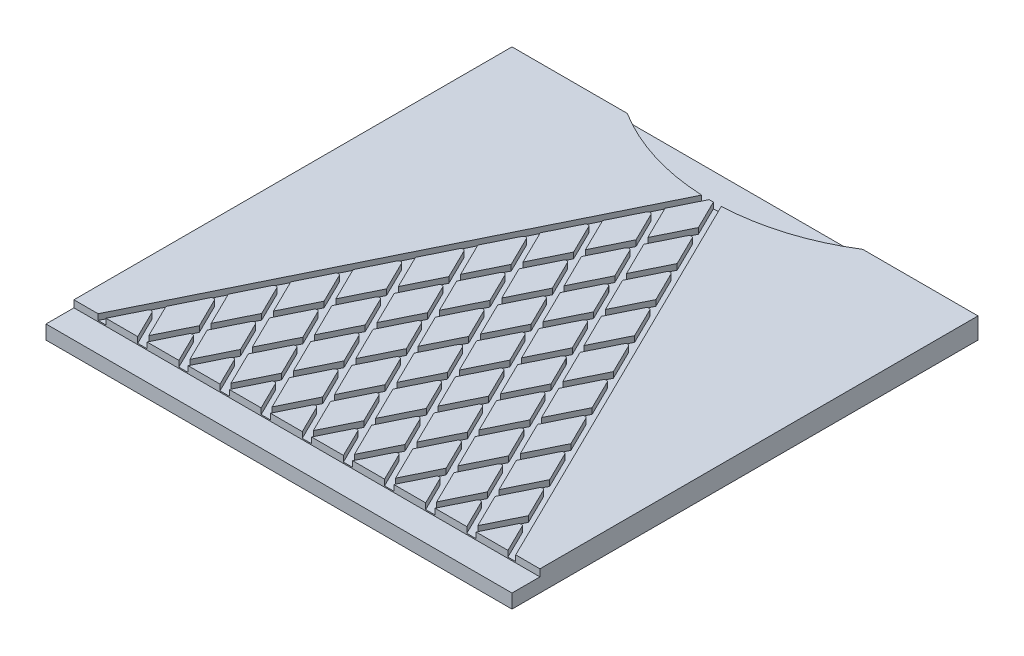
from build123d import *

# Parameters (mm, degrees)
ESQUISSE1_W                     = 400
ESQUISSE1_H                     = 400
BOSS_EXTRU_1_DEPTH              = 18
ENL_V_START                     = -5
ENL_V_DE_MAT_EXTRU_MINCE2_DEPTH = 5
CONG_1_R                        = 2
BACHAUT_DEPTH                   = 6
ESQUISSE5_W                     = 400
ESQUISSE5_H                     = 23.968928741
BACBAS_DEPTH                    = 6


# Read off the part's stored shape, not the designer's step: Enlèv. de mat.-Extru.-Mince2
with BuildPart() as part:
    # Esquisse1 → Boss.-Extru.1 (new body)
    with BuildSketch(Plane(origin=(0, 0, 0), x_dir=(1, 0, 0), z_dir=(0, 1, 0))):
        Rectangle(ESQUISSE1_W, ESQUISSE1_H)
    extrude(amount=BOSS_EXTRU_1_DEPTH)

    # Enlèv. de mat.-Extru.-Mince2 outline → Enlèv. de mat.-Extru.-Mince2 (cut)
    with BuildSketch(Plane(origin=(0, 18, 0), x_dir=(1, 0, 0), z_dir=(0, 1, 0)).offset(ENL_V_START)):
        Polygon((-173.855135903, -178.67927798), (-158.892403305, -148.259175343), (-141.237691827, -184.152227075), (-123.582980348, -148.259175343), (-105.92826887, -184.152227075), (-88.273557392, -148.259175343), (-70.618845913, -184.152227075), (-52.964134435, -148.259175343), (-35.309422957, -184.152227075), (-17.654711478, -148.259175343), (0, -184.152227075), (17.654711478, -148.259175343), (35.309422957, -184.152227075), (52.964134435, -148.259175343), (70.618845913, -184.152227075), (88.273557392, -148.259175343), (105.92826887, -184.152227075), (123.582980348, -148.259175343), (141.237691827, -184.152227075), (158.892403305, -148.259175343), (173.855135903, -178.67927798), (179.239093663, -176.031071259), (0, 188.372395153), (-179.239093663, -176.031071259), align=None)
        Polygon((-155.549137848, -141.462122888), (-141.237691827, -112.366123611), (-126.926245805, -141.462122888), (-141.237691827, -170.558122164), align=None, mode=Mode.SUBTRACT)
        Polygon((-105.92826887, -112.366123611), (-91.616822849, -141.462122888), (-105.92826887, -170.558122164), (-120.239714891, -141.462122888), align=None, mode=Mode.SUBTRACT)
        Polygon((-137.89442637, -105.569071156), (-123.582980348, -76.47307188), (-109.271534327, -105.569071156), (-123.582980348, -134.665070433), align=None, mode=Mode.SUBTRACT)
        Polygon((-56.307399892, -141.462122888), (-70.618845913, -170.558122164), (-84.930291935, -141.462122888), (-70.618845913, -112.366123611), align=None, mode=Mode.SUBTRACT)
        Polygon((-20.997976935, -141.462122888), (-35.309422957, -170.558122164), (-49.620868978, -141.462122888), (-35.309422957, -112.366123611), align=None, mode=Mode.SUBTRACT)
        Polygon((-88.273557392, -76.47307188), (-73.96211137, -105.569071156), (-88.273557392, -134.665070433), (-102.585003413, -105.569071156), align=None, mode=Mode.SUBTRACT)
        Polygon((-38.652688414, -105.569071156), (-52.964134435, -134.665070433), (-67.275580456, -105.569071156), (-52.964134435, -76.47307188), align=None, mode=Mode.SUBTRACT)
        Polygon((-17.654711478, -76.47307188), (-3.343265457, -105.569071156), (-17.654711478, -134.665070433), (-31.9661575, -105.569071156), align=None, mode=Mode.SUBTRACT)
        Polygon((-120.239714891, -69.676019424), (-105.92826887, -40.580020148), (-91.616822849, -69.676019424), (-105.92826887, -98.772018701), align=None, mode=Mode.SUBTRACT)
        Polygon((-70.618845913, -40.580020148), (-56.307399892, -69.676019424), (-70.618845913, -98.772018701), (-84.930291935, -69.676019424), align=None, mode=Mode.SUBTRACT)
        Polygon((-20.997976935, -69.676019424), (-35.309422957, -98.772018701), (-49.620868978, -69.676019424), (-35.309422957, -40.580020148), align=None, mode=Mode.SUBTRACT)
        Polygon((-102.585003413, -33.782967693), (-88.273557392, -4.686968416), (-73.96211137, -33.782967693), (-88.273557392, -62.878966969), align=None, mode=Mode.SUBTRACT)
        Polygon((-52.964134435, -4.686968416), (-38.652688414, -33.782967693), (-52.964134435, -62.878966969), (-67.275580456, -33.782967693), align=None, mode=Mode.SUBTRACT)
        Polygon((-17.654711478, -4.686968416), (-3.343265457, -33.782967693), (-17.654711478, -62.878966969), (-31.9661575, -33.782967693), align=None, mode=Mode.SUBTRACT)
        Polygon((0, -112.366123611), (14.311446021, -141.462122888), (0, -170.558122164), (-14.311446021, -141.462122888), align=None, mode=Mode.SUBTRACT)
        Polygon((20.997976935, -141.462122888), (35.309422957, -112.366123611), (49.620868978, -141.462122888), (35.309422957, -170.558122164), align=None, mode=Mode.SUBTRACT)
        Polygon((56.307399892, -141.462122888), (70.618845913, -112.366123611), (84.930291935, -141.462122888), (70.618845913, -170.558122164), align=None, mode=Mode.SUBTRACT)
        Polygon((17.654711478, -76.47307188), (31.9661575, -105.569071156), (17.654711478, -134.665070433), (3.343265457, -105.569071156), align=None, mode=Mode.SUBTRACT)
        Polygon((38.652688414, -105.569071156), (52.964134435, -76.47307188), (67.275580456, -105.569071156), (52.964134435, -134.665070433), align=None, mode=Mode.SUBTRACT)
        Polygon((88.273557392, -76.47307188), (102.585003413, -105.569071156), (88.273557392, -134.665070433), (73.96211137, -105.569071156), align=None, mode=Mode.SUBTRACT)
        Polygon((120.239714891, -141.462122888), (105.92826887, -170.558122164), (91.616822849, -141.462122888), (105.92826887, -112.366123611), align=None, mode=Mode.SUBTRACT)
        Polygon((126.926245805, -141.462122888), (141.237691827, -112.366123611), (155.549137848, -141.462122888), (141.237691827, -170.558122164), align=None, mode=Mode.SUBTRACT)
        Polygon((109.271534327, -105.569071156), (123.582980348, -76.47307188), (137.89442637, -105.569071156), (123.582980348, -134.665070433), align=None, mode=Mode.SUBTRACT)
        Polygon((0, -40.580020148), (14.311446021, -69.676019424), (0, -98.772018701), (-14.311446021, -69.676019424), align=None, mode=Mode.SUBTRACT)
        Polygon((35.309422957, -40.580020148), (49.620868978, -69.676019424), (35.309422957, -98.772018701), (20.997976935, -69.676019424), align=None, mode=Mode.SUBTRACT)
        Polygon((70.618845913, -40.580020148), (84.930291935, -69.676019424), (70.618845913, -98.772018701), (56.307399892, -69.676019424), align=None, mode=Mode.SUBTRACT)
        Polygon((3.343265457, -33.782967693), (17.654711478, -4.686968416), (31.9661575, -33.782967693), (17.654711478, -62.878966969), align=None, mode=Mode.SUBTRACT)
        Polygon((38.652688414, -33.782967693), (52.964134435, -4.686968416), (67.275580456, -33.782967693), (52.964134435, -62.878966969), align=None, mode=Mode.SUBTRACT)
        Polygon((73.96211137, -33.782967693), (88.273557392, -4.686968416), (102.585003413, -33.782967693), (88.273557392, -62.878966969), align=None, mode=Mode.SUBTRACT)
        Polygon((91.616822849, -69.676019424), (105.92826887, -40.580020148), (120.239714891, -69.676019424), (105.92826887, -98.772018701), align=None, mode=Mode.SUBTRACT)
        Polygon((-84.930291935, 2.110084039), (-70.618845913, 31.206083316), (-56.307399892, 2.110084039), (-70.618845913, -26.985915237), align=None, mode=Mode.SUBTRACT)
        Polygon((-67.275580456, 38.003135771), (-52.964134435, 67.099135047), (-38.652688414, 38.003135771), (-52.964134435, 8.907136494), align=None, mode=Mode.SUBTRACT)
        Polygon((-49.620868978, 2.110084039), (-35.309422957, 31.206083316), (-20.997976935, 2.110084039), (-35.309422957, -26.985915237), align=None, mode=Mode.SUBTRACT)
        Polygon((-31.9661575, 38.003135771), (-17.654711478, 67.099135047), (-3.343265457, 38.003135771), (-17.654711478, 8.907136494), align=None, mode=Mode.SUBTRACT)
        Polygon((-49.620868978, 73.896187503), (-35.309422957, 102.992186779), (-20.997976935, 73.896187503), (-35.309422957, 44.800188226), align=None, mode=Mode.SUBTRACT)
        Polygon((-31.9661575, 109.789239234), (-17.654711478, 138.885238511), (-3.343265457, 109.789239234), (-17.654711478, 80.693239958), align=None, mode=Mode.SUBTRACT)
        Polygon((-14.311446021, 2.110084039), (0, 31.206083316), (14.311446021, 2.110084039), (0, -26.985915237), align=None, mode=Mode.SUBTRACT)
        Polygon((20.997976935, 2.110084039), (35.309422957, 31.206083316), (49.620868978, 2.110084039), (35.309422957, -26.985915237), align=None, mode=Mode.SUBTRACT)
        Polygon((3.343265457, 38.003135771), (17.654711478, 67.099135047), (31.9661575, 38.003135771), (17.654711478, 8.907136494), align=None, mode=Mode.SUBTRACT)
        Polygon((56.307399892, 2.110084039), (70.618845913, 31.206083316), (84.930291935, 2.110084039), (70.618845913, -26.985915237), align=None, mode=Mode.SUBTRACT)
        Polygon((38.652688414, 38.003135771), (52.964134435, 67.099135047), (67.275580456, 38.003135771), (52.964134435, 8.907136494), align=None, mode=Mode.SUBTRACT)
        Polygon((0, 102.992186779), (14.311446021, 73.896187503), (0, 44.800188226), (-14.311446021, 73.896187503), align=None, mode=Mode.SUBTRACT)
        Polygon((20.997976935, 73.896187503), (35.309422957, 102.992186779), (49.620868978, 73.896187503), (35.309422957, 44.800188226), align=None, mode=Mode.SUBTRACT)
        Polygon((3.343265457, 109.789239234), (17.654711478, 138.885238511), (31.9661575, 109.789239234), (17.654711478, 80.693239958), align=None, mode=Mode.SUBTRACT)
        Polygon((-14.311446021, 145.682290966), (0, 174.778290243), (14.311446021, 145.682290966), (0, 116.58629169), align=None, mode=Mode.SUBTRACT)
    extrude(amount=ENL_V_DE_MAT_EXTRU_MINCE2_DEPTH, mode=Mode.SUBTRACT)

    # Congé1
    cong_1_edges = [part.edges().sort_by_distance(p)[0] for p in [
        (-158.892403305, 15.5, 148.259175343),
        (158.892403305, 15.5, 148.259175343),
        (141.237691827, 15.5, 112.366123611),
        (70.618845913, 15.5, 40.580020148),
        (123.582980348, 15.5, 76.47307188),
        (52.964134435, 15.5, 4.686968416),
        (35.309422957, 15.5, -31.206083316),
        (17.654711478, 15.5, 4.686968416),
        (88.273557392, 15.5, 76.47307188),
        (105.92826887, 15.5, 112.366123611),
        (105.92826887, 15.5, 40.580020148),
        (35.309422957, 15.5, 40.580020148),
        (123.582980348, 15.5, 148.259175343),
        (88.273557392, 15.5, 4.686968416),
        (70.618845913, 15.5, -31.206083316),
        (17.654711478, 15.5, -67.099135047),
        (0, 15.5, -31.206083316),
        (52.964134435, 15.5, 76.47307188),
        (70.618845913, 15.5, 112.366123611),
        (88.273557392, 15.5, 148.259175343),
        (52.964134435, 15.5, -67.099135047),
        (-17.654711478, 15.5, 4.686968416),
        (0, 15.5, 40.580020148),
        (17.654711478, 15.5, 76.47307188),
        (0, 15.5, -102.992186779),
        (35.309422957, 15.5, 112.366123611),
        (-35.309422957, 15.5, 40.580020148),
        (35.309422957, 15.5, -102.992186779),
        (-17.654711478, 15.5, -67.099135047),
        (-17.654711478, 15.5, 76.47307188),
        (52.964134435, 15.5, 148.259175343),
        (17.654711478, 15.5, -138.885238511),
        (-35.309422957, 15.5, -31.206083316),
        (0, 15.5, 112.366123611),
        (17.654711478, 15.5, 148.259175343),
        (0, 15.5, -174.778290243),
        (-17.654711478, 15.5, -138.885238511),
        (-52.964134435, 15.5, 4.686968416),
        (-52.964134435, 15.5, 76.47307188),
        (-35.309422957, 15.5, -102.992186779),
        (-35.309422957, 15.5, 112.366123611),
        (-17.654711478, 15.5, 148.259175343),
        (-52.964134435, 15.5, -67.099135047),
        (-70.618845913, 15.5, 40.580020148),
        (-70.618845913, 15.5, -31.206083316),
        (-88.273557392, 15.5, 76.47307188),
        (-70.618845913, 15.5, 112.366123611),
        (-52.964134435, 15.5, 148.259175343),
        (-88.273557392, 15.5, 4.686968416),
        (-105.92826887, 15.5, 112.366123611),
        (-88.273557392, 15.5, 148.259175343),
        (-105.92826887, 15.5, 40.580020148),
        (-123.582980348, 15.5, 76.47307188),
        (-141.237691827, 15.5, 112.366123611),
        (-123.582980348, 15.5, 148.259175343),
    ]]
    fillet(cong_1_edges, radius=CONG_1_R)

    # Esquisse3 → BacHaut (cut)
    with BuildSketch(Plane(origin=(0, 18, 0), x_dir=(1, 0, 0), z_dir=(0, 1, 0))):
        with BuildLine():
            Line((-101.04956725, 200), (101.04956725, 200))
            ThreePointArc((101.04956725, 200), (0, 171.040224612), (-101.04956725, 200))
        make_face()
    extrude(amount=-BACHAUT_DEPTH, mode=Mode.SUBTRACT)

    # Esquisse5 → BacBas (cut)
    with BuildSketch(Plane(origin=(0, 18, 0), x_dir=(1, 0, 0), z_dir=(0, 1, 0))):
        with Locations((0, -188.015535629)):
            Rectangle(ESQUISSE5_W, ESQUISSE5_H)
    extrude(amount=-BACBAS_DEPTH, mode=Mode.SUBTRACT)


solid = part.part
